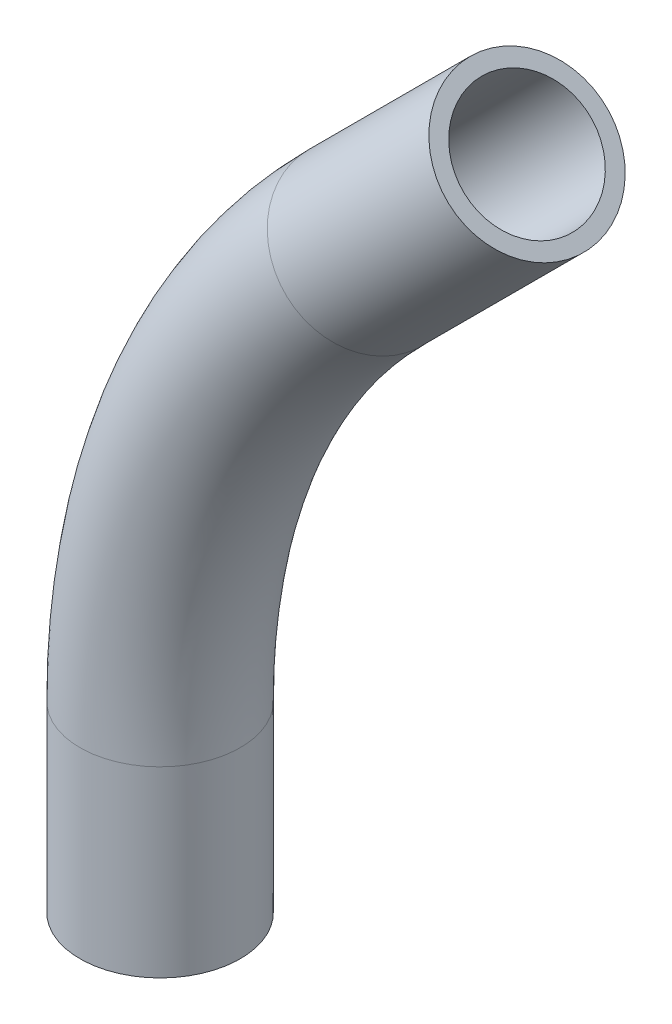
from build123d import *

# Parameters (mm, degrees)
ROUTE_R                       = 16.7005
ELBOWSHELL_T                  = -3.3782
SKETCH2_R                     = 16.7005
SKETCH2_R_2                   = 13.3223
ELBOWEXTENSION_EXTRUDE1_DEPTH = 47.625
SKETCH3_R                     = 16.7005
SKETCH3_R_2                   = 13.3223
ELBOWEXTENSION_EXTRUDE2_DEPTH = 38.1


with BuildPart() as part:
    # Elbow: sweep along a path in ElbowArc
    with BuildLine(Plane.XY) as elbow_path:
        ThreePointArc((-146.05, 0), (-134.932605723, 55.890915297), (-103.272945392, 103.272945392))
    # Route → Elbow (sweep)
    with BuildSketch(Plane(origin=(0, 0, 0), x_dir=(1, 0, 0), z_dir=(0, 1, 0))):
        with Locations((-146.05, 0)):
            Circle(ROUTE_R)
    sweep(path=elbow_path.line)

    # ElbowShell
    elbowshell_openings = [part.faces().sort_by_distance(p)[0] for p in [
        (-103.272945392, 103.272945392, 0),
        (-146.05, 0, 0),
    ]]
    offset(amount=ELBOWSHELL_T, openings=elbowshell_openings, kind=Kind.INTERSECTION)

    # Sketch2 → ElbowExtension-Extrude1 (add)
    with BuildSketch(Plane(origin=(0, 0, 0), x_dir=(0, 0, -1), z_dir=(0.7071067811865487, 0.7071067811865464, 0))):
        with Locations((0, 146.05)):
            Circle(SKETCH2_R)
        with Locations((0, 146.05)):
            Circle(SKETCH2_R_2, mode=Mode.SUBTRACT)
    extrude(amount=ELBOWEXTENSION_EXTRUDE1_DEPTH)

    # Sketch3 → ElbowExtension-Extrude2 (add)
    with BuildSketch(Plane.XZ):
        with Locations((-146.05, 0)):
            Circle(SKETCH3_R)
        with Locations((-146.05, 0)):
            Circle(SKETCH3_R_2, mode=Mode.SUBTRACT)
    extrude(amount=ELBOWEXTENSION_EXTRUDE2_DEPTH)


solid = part.part
